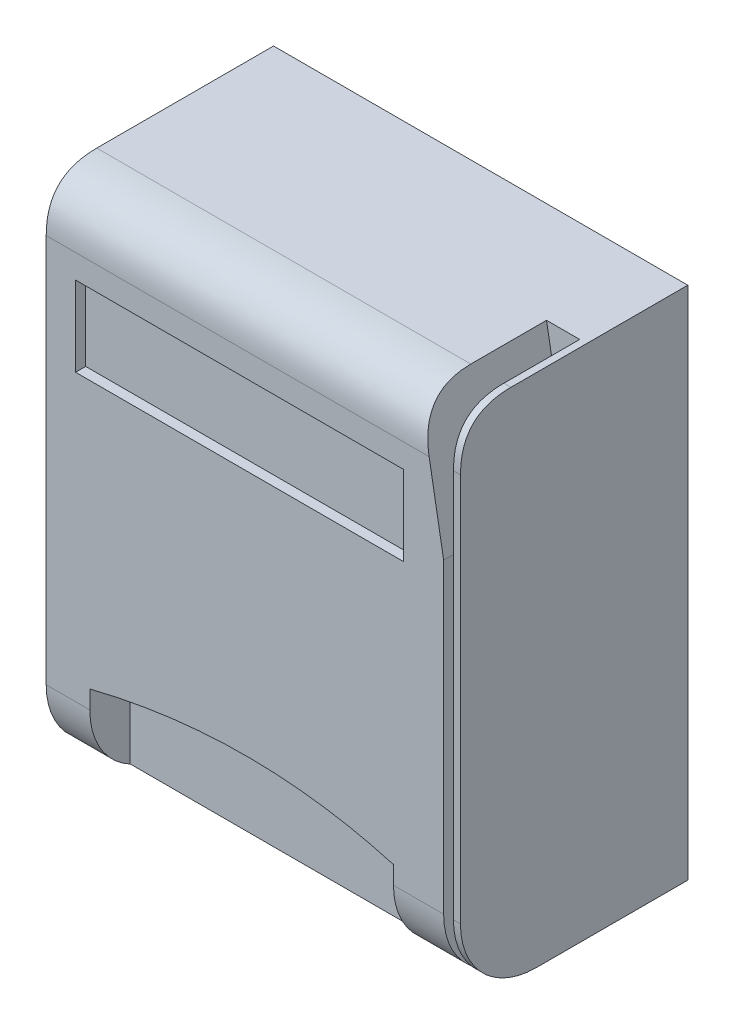
from build123d import *

# Parameters (mm, degrees)
SKETCH1_W           = 82
SKETCH1_H           = 102
BOSS_EXTRUDE1_DEPTH = 45
FILLET1_R           = 15
FILLET2_SIZE        = 10
SKETCH2_W           = 1.935509438
SKETCH2_H           = 108.039568053
CUT_EXTRUDE1_DEPTH  = 25
CUT_EXTRUDE2_DEPTH  = 25
SKETCH4_W           = 64.944344057
SKETCH4_H           = 15.809351463
CUT_EXTRUDE3_DEPTH  = 2
CUT_EXTRUDE4_DEPTH  = 8
SKETCH6_W           = 60.105213435
SKETCH6_H           = 24.98512856
CUT_EXTRUDE5_DEPTH  = 8
SKETCH7_R           = 1.5
CUT_EXTRUDE6_DEPTH  = 8


with BuildPart() as part:
    # Sketch1 → Boss-Extrude1 (new body)
    with BuildSketch(Plane.XY):
        with Locations((-4.71634799, 11.800448269)):
            Rectangle(SKETCH1_W, SKETCH1_H)
    extrude(amount=BOSS_EXTRUDE1_DEPTH)

    # Fillet1
    fillet1_edges = [part.edges().sort_by_distance(p)[0] for p in [
        (-4.71634799, -39.199551731, 45),
    ]]
    fillet(fillet1_edges, radius=FILLET1_R)

    # Fillet2
    # a fillet whose section is not a circle: 10 mm, written as the material it takes off along each edge
    with BuildSketch(Plane(origin=(-70.71634799, 62.800448269, 45), x_dir=(0, -1, 0), z_dir=(1, 0, 0))) as fillet2_piece_1:
        with BuildLine():
            Bezier((FILLET2_SIZE, 0), (0, 0), (0, FILLET2_SIZE), weights=[1, 1, 1])
            Line((0, FILLET2_SIZE), (0, 0))
            Line((0, 0), (FILLET2_SIZE, 0))
        make_face()
    extrude(amount=132, mode=Mode.SUBTRACT)

    # Sketch2 → Cut-Extrude1 (cut)
    with BuildSketch(Plane.XY.offset(45)):
        with Locations((33.920109965, 11.021338758)):
            Rectangle(SKETCH2_W, SKETCH2_H)
    extrude(amount=-CUT_EXTRUDE1_DEPTH, mode=Mode.SUBTRACT)

    # Sketch3 → Cut-Extrude2 (cut)
    with BuildSketch(Plane.XY.offset(45)):
        Polygon((32.952355246, 36.51166629), (28.204087152, 63.475951779), (32.952355246, 63.475951779), align=None)
    extrude(amount=-CUT_EXTRUDE2_DEPTH, mode=Mode.SUBTRACT)

    # Sketch4 → Cut-Extrude3 (cut)
    with BuildSketch(Plane.XY.offset(45)):
        with Locations((-7.429597209, 40.183157287)):
            Rectangle(SKETCH4_W, SKETCH4_H)
    extrude(amount=-CUT_EXTRUDE3_DEPTH, mode=Mode.SUBTRACT)

    # Sketch5 → Cut-Extrude4 (cut)
    with BuildSketch(Plane.XY.offset(45)):
        with BuildLine():
            Line((-37.079623524, -20.597881777), (22.815677351, -20.597881777))
            add(Edge.make_bspline(
                [(-37.079623524, -20.597881777), (-5.102026038, -12.590864718), (22.815677351, -20.597881777)],
                knots=[0, 0, 0, 0.561199211, 0.561199211, 0.561199211], degree=2))
        make_face()
    extrude(amount=-CUT_EXTRUDE4_DEPTH, mode=Mode.SUBTRACT)

    # Sketch6 → Cut-Extrude5 (cut)
    with BuildSketch(Plane.XY.offset(45)):
        with Locations((-7.027016807, -33.090446057)):
            Rectangle(SKETCH6_W, SKETCH6_H)
    extrude(amount=-CUT_EXTRUDE5_DEPTH, mode=Mode.SUBTRACT)

    # Sketch7 → Cut-Extrude6 (cut)
    with BuildSketch(Plane(origin=(0, 0, 0), x_dir=(-1, 0, 0), z_dir=(0, 0, -1))):
        with Locations((-28.78365201, 47.800448269)):
            Circle(SKETCH7_R)
        with Locations((38.21634799, 47.800448269)):
            Circle(SKETCH7_R)
        with Locations((38.21634799, -24.199551731)):
            Circle(SKETCH7_R)
        with Locations((-28.78365201, -24.199551731)):
            Circle(SKETCH7_R)
    extrude(amount=-CUT_EXTRUDE6_DEPTH, mode=Mode.SUBTRACT)


solid = part.part
